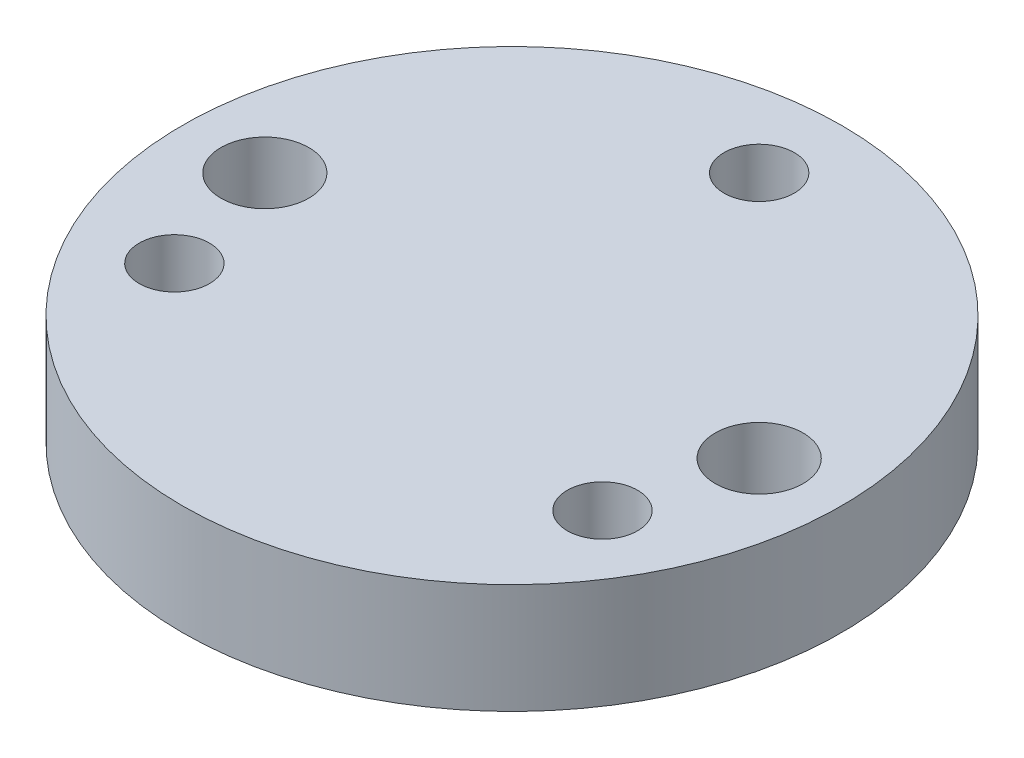
from build123d import *

# Parameters (mm, degrees)
SKETCH1_R             = 30
BOSS_EXTRUDE1_DEPTH   = 10
F_8_0MM_DOWEL_HOLE1_D = 8
M6_CLEARANCE_HOLE1_D  = 6.4


with BuildPart() as part:
    # Sketch1 → Boss-Extrude1 (new body)
    with BuildSketch(Plane(origin=(0, 0, 0), x_dir=(1, 0, 0), z_dir=(0, 1, 0))):
        Circle(SKETCH1_R)
    extrude(amount=-BOSS_EXTRUDE1_DEPTH)

    # Ø8.0mm Dowel Hole1 (through all)
    with Locations(Plane(origin=(0, 0, 0), x_dir=(1, 0, 0), z_dir=(0, 1, 0))):
        with Locations((-22.5, 0), (22.5, 0)):
            Hole(F_8_0MM_DOWEL_HOLE1_D / 2)

    # M6 Clearance Hole1 (through all)
    with Locations(Plane(origin=(0, 0, 0), x_dir=(1, 0, 0), z_dir=(0, 1, 0))):
        with Locations((19.485571585, -11.25), (-19.485571585, -11.25), (0, 22.5)):
            Hole(M6_CLEARANCE_HOLE1_D / 2)


solid = part.part
